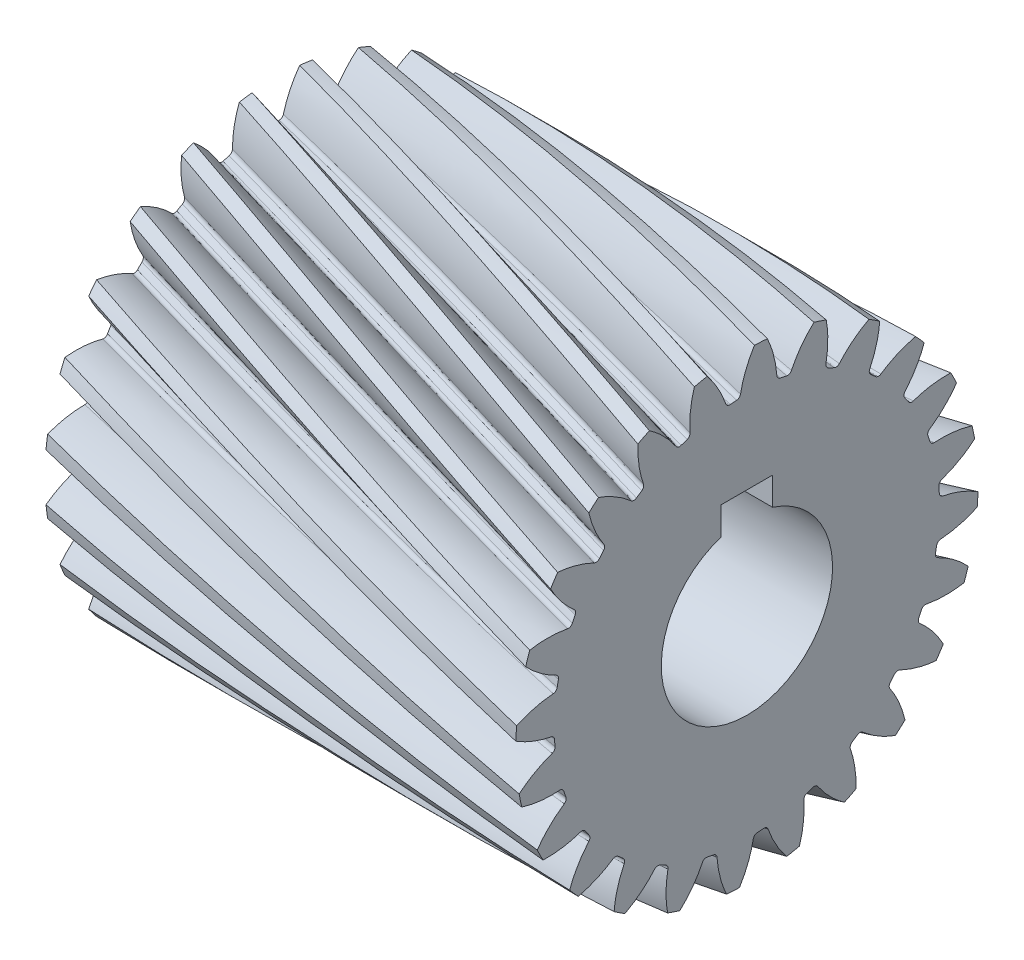
from build123d import *

# Parameters (mm, degrees)
BASPROSKE_W            = 55
BASPROSKE_H            = 26.999973948
TOOTHCUTRH_PITCH       = 581.650609821
TOOTHCUTRH_HEIGHT      = 55
TOOTHCUTRH_RADIUS      = 26.999973948
TOOTHCUTRH_START_ANGLE = -90
TEETHCUTSRH_COUNT      = 24
TEETHCUTSRH_ANGLE      = 345
BORSKE_R               = 10
BORE_DEPTH             = 68.7500025
KEYSKE_W               = 6
KEYSKE_H               = 12.8
KEYWAY_DEPTH           = 68.7500025


with BuildPart() as part:
    # BasProSke → Base-Revolve (revolve)
    with BuildSketch(Plane(origin=(0, 0, 0), x_dir=(1, 0, 0), z_dir=(0, 1, 0)), mode=Mode.PRIVATE) as base_revolve_sk:
        with Locations((27.5, 13.499986974)):
            Rectangle(BASPROSKE_W, BASPROSKE_H)
    revolve(base_revolve_sk.sketch.rotate(Axis((-10, 0, 0), (1, 0, 0)), 180), axis=Axis((-10, 0, 0), (1, 0, 0)))

    # ToothCutRH: sweep along a helix
    with BuildLine() as toothcutrh_path:
        add(Helix(TOOTHCUTRH_PITCH, TOOTHCUTRH_HEIGHT, TOOTHCUTRH_RADIUS, center=(0, 0, 0), direction=(1, 0, 0), mode=Mode.PRIVATE).rotate(Axis((0, 0, 0), (1, 0, 0)), TOOTHCUTRH_START_ANGLE))
    # TooCutSkeRH → ToothCutRH (sweep, cut)
    with BuildSketch(Plane(origin=(0, 0, 0), x_dir=(0, 0, -1), z_dir=(1, 0, 0))):
        with BuildLine():
            ThreePointArc((0.375910093, 22.496833539), (0, 22.499973948), (-0.375910093, 22.496833539))
            ThreePointArc((-0.375910093, 22.496833539), (-0.686178257, 22.597940321), (-0.868364148, 22.868674907))
            ThreePointArc((-0.868364148, 22.868674907), (-1.850766364, 25.378208767), (-3.368423193, 27.605222925))
            ThreePointArc((-3.368423193, 27.605222925), (0, 27.809973167), (3.368423193, 27.605222925))
            ThreePointArc((3.368423193, 27.605222925), (1.850766364, 25.378208767), (0.868364148, 22.868674907))
            ThreePointArc((0.868364148, 22.868674907), (0.686178257, 22.597940321), (0.375910093, 22.496833539))
        make_face()
    toothcutrh = sweep(path=toothcutrh_path.line, is_frenet=True, mode=Mode.SUBTRACT)

    # TeethCutsRH: ToothCutRH ×24 about axis
    teethcutsrh_axis = Axis((-10, 0, 0), (1, 0, 0))
    for i in range(1, TEETHCUTSRH_COUNT):
        add(toothcutrh.rotate(teethcutsrh_axis, i * TEETHCUTSRH_ANGLE / (TEETHCUTSRH_COUNT - 1)), mode=Mode.SUBTRACT)

    # BorSke → Bore (cut, symmetric)
    with BuildSketch(Plane(origin=(0, 0, 0), x_dir=(0, 0, -1), z_dir=(1, 0, 0))):
        with Locations(Location((0, 0, 0), (0, 0, 180))):
            Circle(BORSKE_R)
    extrude(amount=BORE_DEPTH, both=True, mode=Mode.SUBTRACT)

    # KeySke → Keyway (cut, symmetric)
    with BuildSketch(Plane(origin=(0, 0, 0), x_dir=(0, 0, -1), z_dir=(1, 0, 0))):
        with Locations((0, 6.4)):
            Rectangle(KEYSKE_W, KEYSKE_H)
    extrude(amount=KEYWAY_DEPTH, both=True, mode=Mode.SUBTRACT)


solid = part.part
